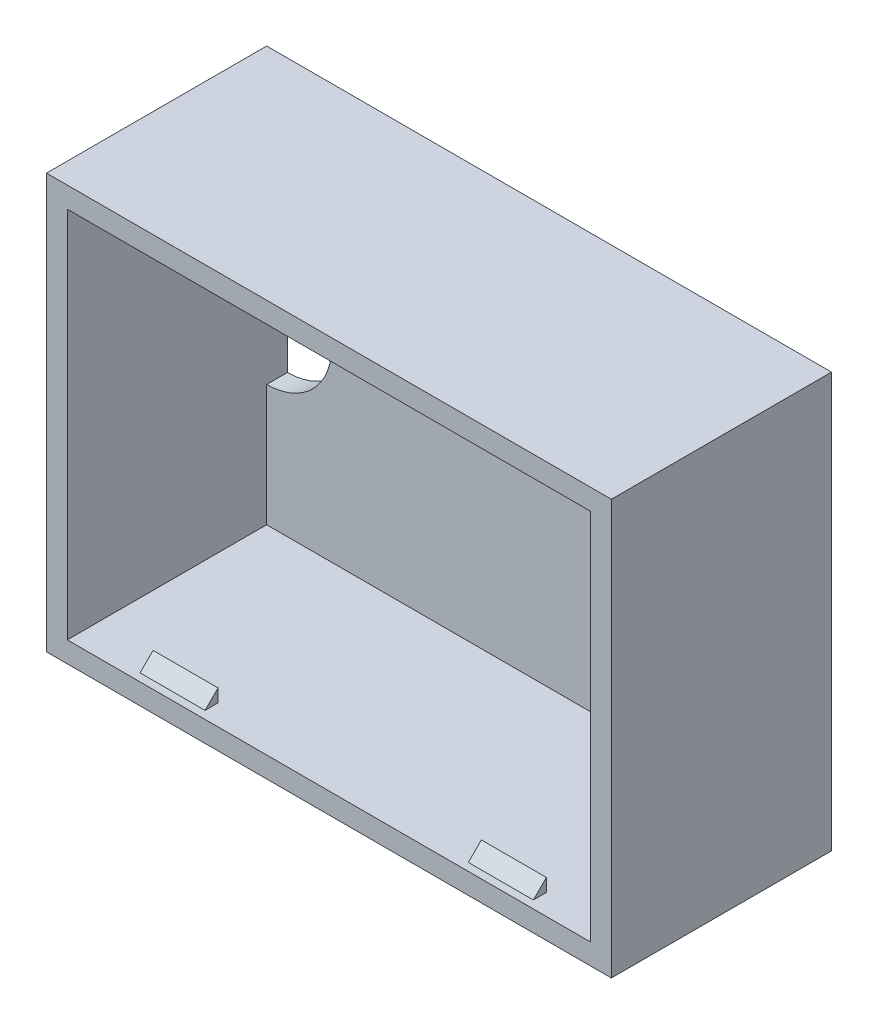
from build123d import *

# Parameters (mm, degrees)
SKETCH2_W           = 31.9
SKETCH2_H           = 43.46
BOSS_EXTRUDE1_DEPTH = 16.94
SHELL1_T            = -1.6
SKETCH3_W           = 5
SKETCH3_H           = 1
BOSS_EXTRUDE2_DEPTH = 1
SKETCH4_W           = 5
SKETCH4_H           = 1
BOSS_EXTRUDE3_DEPTH = 1
CHAMFER1_SIZE       = 1
CUT_EXTRUDE1_DEPTH  = 32.014690068


with BuildPart() as part:
    # Sketch2 → Boss-Extrude1 (new body)
    with BuildSketch(Plane(origin=(0, 0, 0), x_dir=(0, 1, 0), z_dir=(0, 0, 1))):
        Rectangle(SKETCH2_W, SKETCH2_H)
    extrude(amount=BOSS_EXTRUDE1_DEPTH)

    # Shell1
    shell1_openings = [part.faces().sort_by_distance(p)[0] for p in [
        (0, 0, 16.94),
    ]]
    offset(amount=SHELL1_T, openings=shell1_openings, kind=Kind.INTERSECTION)

    # Sketch3 → Boss-Extrude2 (add)
    with BuildSketch(Plane(origin=(0, -14.35, 0), x_dir=(-1, 0, 0), z_dir=(0, 1, 0))):
        with Locations((-12.63, 15.84)):
            Rectangle(SKETCH3_W, SKETCH3_H)
        with Locations((12.63, 15.84)):
            Rectangle(SKETCH3_W, SKETCH3_H)
    extrude(amount=BOSS_EXTRUDE2_DEPTH)

    # Sketch4 → Boss-Extrude3 (add)
    with BuildSketch(Plane.XZ.offset(-14.35)):
        with Locations((-12.63, 15.84)):
            Rectangle(SKETCH4_W, SKETCH4_H)
        with Locations((12.63, 15.84)):
            Rectangle(SKETCH4_W, SKETCH4_H)
    extrude(amount=BOSS_EXTRUDE3_DEPTH)

    # Chamfer1
    chamfer1_edges = [part.edges().sort_by_distance(p)[0] for p in [
        (-12.63, -13.35, 16.34),
        (12.63, -13.35, 16.34),
        (-12.63, 13.35, 16.34),
        (12.63, 13.35, 16.34),
    ]]
    chamfer(chamfer1_edges, length=CHAMFER1_SIZE - 0.0001)  # a hair under: the kernel refuses the full size

    # Sketch5 → Cut-Extrude1 (cut, through all)
    with BuildSketch(Plane.XY.offset(1.6)):
        with BuildLine():
            Line((-20.13, 5), (-20.13, -5))
            ThreePointArc((-20.13, -5), (-15.13, 0), (-20.13, 5))
        make_face()
    extrude(amount=-CUT_EXTRUDE1_DEPTH, mode=Mode.SUBTRACT)


solid = part.part
